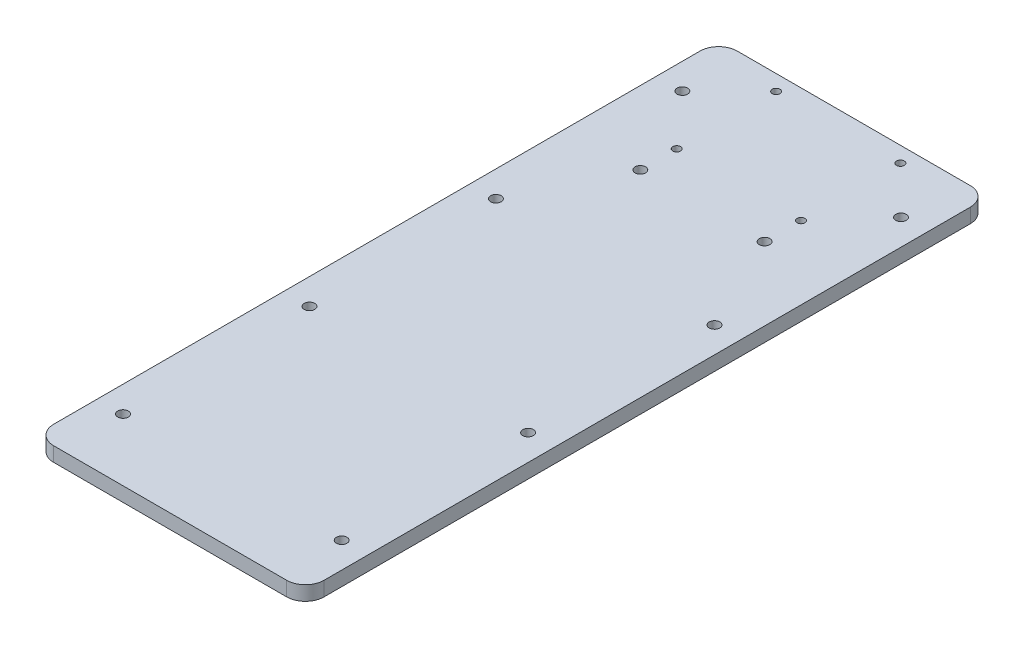
from build123d import *

# Parameters (mm, degrees)
SKETCH1_R           = 2.159
SKETCH1_R_2         = 1.5875
BOSS_EXTRUDE1_DEPTH = 5.8928


with BuildPart() as part:
    # Sketch1 → Boss-Extrude1 (new body)
    with BuildSketch(Plane(origin=(0, 0, 0), x_dir=(1, 0, 0), z_dir=(0, 1, 0))):
        with BuildLine():
            Line((95.25, 0), (0, 0))
            ThreePointArc((0, 0), (-5.388153673, -2.231846327), (-7.62, -7.62))
            Line((-7.62, -7.62), (-7.62, -271.78))
            ThreePointArc((-7.62, -271.78), (-5.388153673, -277.168153673), (0, -279.4))
            Line((0, -279.4), (95.25, -279.4))
            ThreePointArc((95.25, -279.4), (100.638153673, -277.168153673), (102.87, -271.78))
            Line((102.87, -271.78), (102.87, -7.62))
            ThreePointArc((102.87, -7.62), (100.638153673, -2.231846327), (95.25, 0))
        make_face()
        with Locations((2.9464, -254)):
            Circle(SKETCH1_R, mode=Mode.SUBTRACT)
        with Locations((2.9464, -177.8)):
            Circle(SKETCH1_R, mode=Mode.SUBTRACT)
        with Locations((92.3036, -254)):
            Circle(SKETCH1_R, mode=Mode.SUBTRACT)
        with Locations((92.3036, -177.8)):
            Circle(SKETCH1_R, mode=Mode.SUBTRACT)
        with Locations((2.9464, -101.6)):
            Circle(SKETCH1_R, mode=Mode.SUBTRACT)
        with Locations((2.9464, -25.4)):
            Circle(SKETCH1_R, mode=Mode.SUBTRACT)
        with Locations((22.225, -61.860219924)):
            Circle(SKETCH1_R, mode=Mode.SUBTRACT)
        with Locations((22.225, -46.99)):
            Circle(SKETCH1_R_2, mode=Mode.SUBTRACT)
        with Locations((22.225, -6.35)):
            Circle(SKETCH1_R_2, mode=Mode.SUBTRACT)
        with Locations((92.3036, -101.6)):
            Circle(SKETCH1_R, mode=Mode.SUBTRACT)
        with Locations((73.025, -61.860219924)):
            Circle(SKETCH1_R, mode=Mode.SUBTRACT)
        with Locations((73.025, -46.99)):
            Circle(SKETCH1_R_2, mode=Mode.SUBTRACT)
        with Locations((73.025, -6.35)):
            Circle(SKETCH1_R_2, mode=Mode.SUBTRACT)
        with Locations((92.3036, -25.4)):
            Circle(SKETCH1_R, mode=Mode.SUBTRACT)
    extrude(amount=BOSS_EXTRUDE1_DEPTH)


solid = part.part
